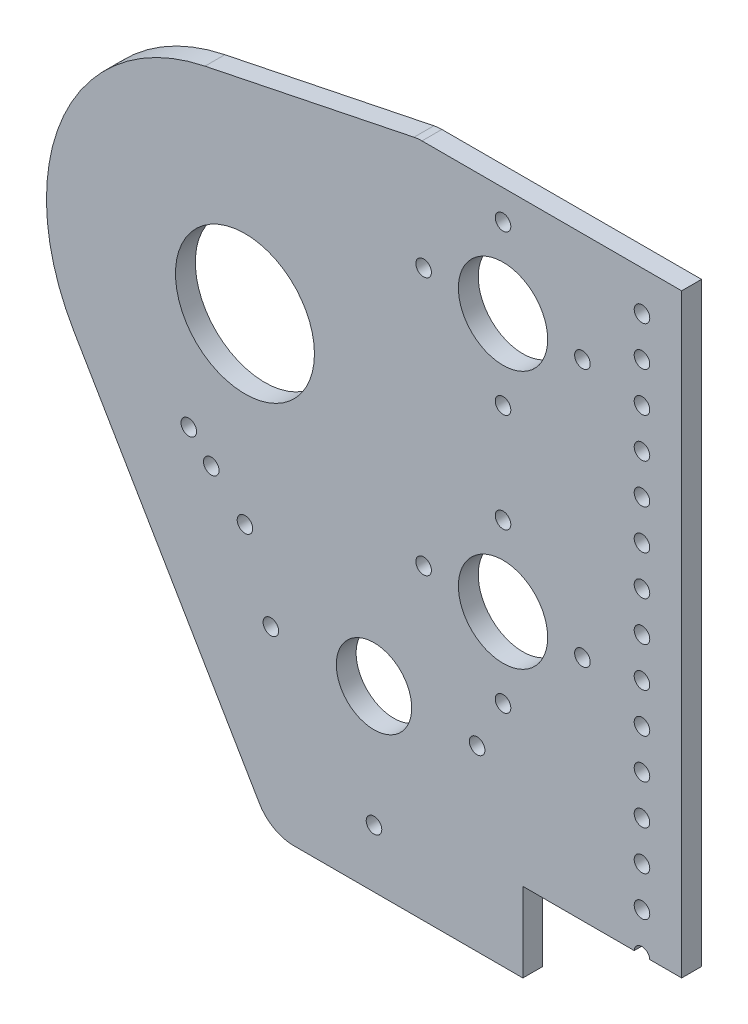
from build123d import *

# Parameters (mm, degrees)
SKETCH1_R                          = 22.225
SKETCH1_R_2                        = 14.2875
SKETCH1_R_3                        = 12.065
BOSS_EXTRUDE1_DEPTH                = 6.35
F_9_0_196_DIAMETER_HOLE1_OUTLINE_R = 2.4892
F_9_0_196_DIAMETER_HOLE1_DEPTH     = 6.35
SKETCH5_W                          = 158.475738421
SKETCH5_H                          = 23.945509926
CUT_EXTRUDE1_DEPTH                 = 198.577920905
FILLET1_R                          = 12.7
SKETCH9_W                          = 50.8
SKETCH9_H                          = 25.4
CUT_EXTRUDE2_DEPTH                 = 198.577920905


# Read off the part's stored shape, not the designer's step: #9 (0.196) Diameter Hole1
with BuildPart() as part:
    # Sketch1 → Boss-Extrude1 (new body)
    with BuildSketch(Plane(origin=(0, 0, 0), x_dir=(0, 1, 0), z_dir=(0, 0, 1))):
        with BuildLine():
            Line((80.9625, -82.55), (80.9625, -139.7))
            Line((80.9625, -139.7), (-139.573, -139.7))
            Line((-139.573, -139.7), (-139.573, -8.2804))
            Line((-139.573, -8.2804), (-32.138994776, 54.766184957))
            ThreePointArc((-32.138994776, 54.766184957), (25.818013961, 58.014482288), (62.200093141, 12.782738878))
            Line((62.200093141, 12.782738878), (80.150058213, -74.560788201))
            ThreePointArc((80.150058213, -74.560788201), (80.758867143, -78.534792445), (80.9625, -82.55))
        make_face()
        with Locations(Location((0, 0, 0), (0, 0, 270))):
            Circle(SKETCH1_R, mode=Mode.SUBTRACT)
        with Locations(Location((-41.275, -82.55, 0), (0, 0, 270))):
            Circle(SKETCH1_R_2, mode=Mode.SUBTRACT)
        with Locations(Location((41.275, -82.55, 0), (0, 0, 270))):
            Circle(SKETCH1_R_2, mode=Mode.SUBTRACT)
        with Locations(Location((-82.55, -41.275, 0), (0, 0, 270))):
            Circle(SKETCH1_R_3, mode=Mode.SUBTRACT)
    extrude(amount=BOSS_EXTRUDE1_DEPTH)

    # #9 (0.196) Diameter Hole1 outline → #9 (0.196) Diameter Hole1 (cut)
    with BuildSketch(Plane.XY):
        with Locations((101.6, -127)):
            Circle(F_9_0_196_DIAMETER_HOLE1_OUTLINE_R)
        with Locations((114.3, -127)):
            Circle(F_9_0_196_DIAMETER_HOLE1_OUTLINE_R)
        with Locations((127, 63.5)):
            Circle(F_9_0_196_DIAMETER_HOLE1_OUTLINE_R)
        with Locations((127, 50.8)):
            Circle(F_9_0_196_DIAMETER_HOLE1_OUTLINE_R)
        with Locations((127, 38.1)):
            Circle(F_9_0_196_DIAMETER_HOLE1_OUTLINE_R)
        with Locations((127, 25.4)):
            Circle(F_9_0_196_DIAMETER_HOLE1_OUTLINE_R)
        with Locations((127, 12.7)):
            Circle(F_9_0_196_DIAMETER_HOLE1_OUTLINE_R)
        with Locations((127, 0)):
            Circle(F_9_0_196_DIAMETER_HOLE1_OUTLINE_R)
        with Locations((8.2804, -82.55)):
            Circle(F_9_0_196_DIAMETER_HOLE1_OUTLINE_R)
        with Locations((41.275, -121.031)):
            Circle(F_9_0_196_DIAMETER_HOLE1_OUTLINE_R)
        with Locations((74.2696, -82.55)):
            Circle(F_9_0_196_DIAMETER_HOLE1_OUTLINE_R)
        with Locations((0, -58.355558977)):
            Circle(F_9_0_196_DIAMETER_HOLE1_OUTLINE_R)
        with Locations((-10.779281546, -47.582226654)):
            Circle(F_9_0_196_DIAMETER_HOLE1_OUTLINE_R)
        with Locations((-17.965469244, -40.400005105)):
            Circle(F_9_0_196_DIAMETER_HOLE1_OUTLINE_R)
        with Locations((127, -12.7)):
            Circle(F_9_0_196_DIAMETER_HOLE1_OUTLINE_R)
        with Locations((127, -25.4)):
            Circle(F_9_0_196_DIAMETER_HOLE1_OUTLINE_R)
        with Locations((127, -38.1)):
            Circle(F_9_0_196_DIAMETER_HOLE1_OUTLINE_R)
        with Locations((127, -50.8)):
            Circle(F_9_0_196_DIAMETER_HOLE1_OUTLINE_R)
        with Locations((127, -63.5)):
            Circle(F_9_0_196_DIAMETER_HOLE1_OUTLINE_R)
        with Locations((127, -76.2)):
            Circle(F_9_0_196_DIAMETER_HOLE1_OUTLINE_R)
        with Locations((127, -88.9)):
            Circle(F_9_0_196_DIAMETER_HOLE1_OUTLINE_R)
        with Locations((127, -101.6)):
            Circle(F_9_0_196_DIAMETER_HOLE1_OUTLINE_R)
        with Locations((127, -114.3)):
            Circle(F_9_0_196_DIAMETER_HOLE1_OUTLINE_R)
        with Locations((127, -127)):
            Circle(F_9_0_196_DIAMETER_HOLE1_OUTLINE_R)
        with Locations((107.95, -41.275)):
            Circle(F_9_0_196_DIAMETER_HOLE1_OUTLINE_R)
        with Locations((82.55, -66.675)):
            Circle(F_9_0_196_DIAMETER_HOLE1_OUTLINE_R)
        with Locations((57.15, -41.275)):
            Circle(F_9_0_196_DIAMETER_HOLE1_OUTLINE_R)
        with Locations((82.55, -15.875)):
            Circle(F_9_0_196_DIAMETER_HOLE1_OUTLINE_R)
        with Locations((82.55, 15.875)):
            Circle(F_9_0_196_DIAMETER_HOLE1_OUTLINE_R)
        with Locations((107.95, 41.275)):
            Circle(F_9_0_196_DIAMETER_HOLE1_OUTLINE_R)
        with Locations((82.55, 66.675)):
            Circle(F_9_0_196_DIAMETER_HOLE1_OUTLINE_R)
        with Locations((57.15, 41.275)):
            Circle(F_9_0_196_DIAMETER_HOLE1_OUTLINE_R)
    extrude(amount=F_9_0_196_DIAMETER_HOLE1_DEPTH, mode=Mode.SUBTRACT)

    # Sketch5 → Cut-Extrude1 (cut, through all)
    with BuildSketch(Plane.XY.offset(6.35)):
        with Locations((102.364485766, 88.172754963)):
            Rectangle(SKETCH5_W, SKETCH5_H)
    extrude(amount=-CUT_EXTRUDE1_DEPTH, mode=Mode.SUBTRACT)

    # Fillet1
    fillet1_edges = [part.edges().sort_by_distance(p)[0] for p in [
        (8.2804, -139.573, 3.175),
        (55.340025647, 76.2, 3.175),
    ]]
    fillet(fillet1_edges, radius=FILLET1_R)

    # Sketch9 → Cut-Extrude2 (cut, through all)
    with BuildSketch(Plane.XY.offset(6.35)):
        with Locations((114.3, -126.873)):
            Rectangle(SKETCH9_W, SKETCH9_H)
    extrude(amount=-CUT_EXTRUDE2_DEPTH, mode=Mode.SUBTRACT)


solid = part.part
